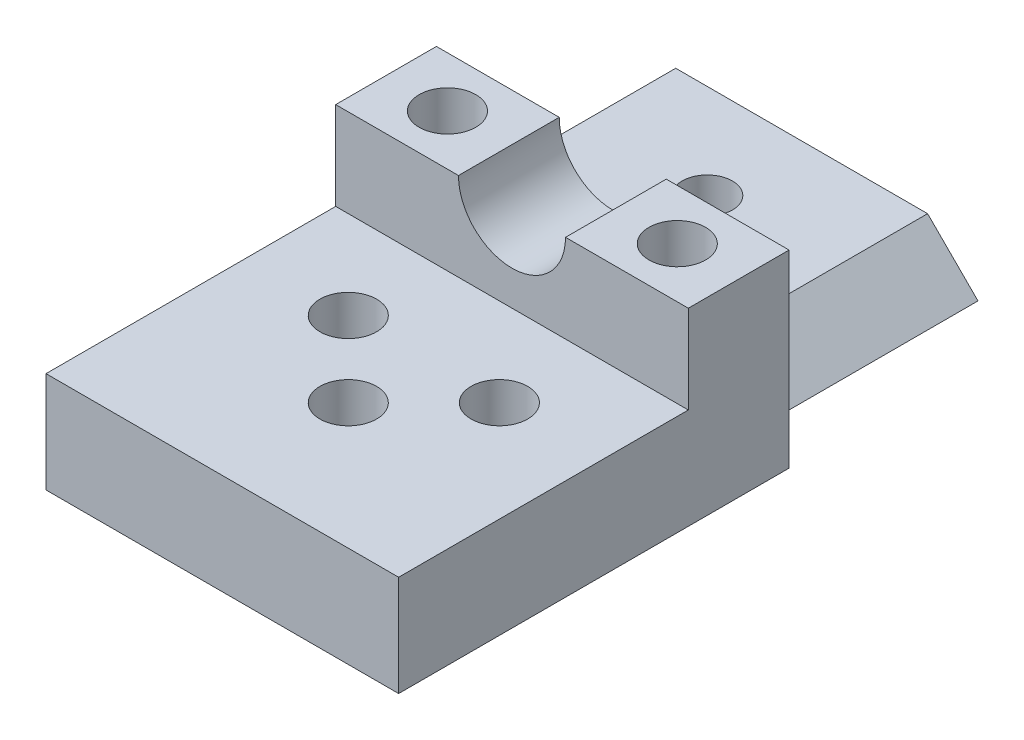
from build123d import *

# Parameters (mm, degrees)
SKETCH1_W                             = 28
SKETCH1_H                             = 46
SKETCH1_R                             = 2
BOSS_EXTRUDE1_DEPTH                   = 8
SKETCH6_R                             = 2.25
DRAGCHAINMOUNTHOLESCUT_EXTRUDE1_DEPTH = 4
SKETCH2_W                             = 28
SKETCH2_H                             = 8
BRIDGEBOSS_EXTRUDE2_DEPTH             = 7
GROMMETCUT_EXTRUDE3_DEPTH             = 40.217343102
BRIDGEMOUNTHOLESSKETCH4_R             = 2.25
BRIDGEMOUNTHOLESCUT_EXTRUDE4_DEPTH    = 4
SKETCH5_W                             = 15
SKETCH5_H                             = 4
EDGECUT_EXTRUDE5_DEPTH                = 56.901699437
CHAMFER1_SIZE                         = 4


with BuildPart() as part:
    # Sketch1 → Boss-Extrude1 (new body)
    with BuildSketch(Plane(origin=(0, 0, 0), x_dir=(1, 0, 0), z_dir=(0, 1, 0))):
        with Locations((14, 23)):
            Rectangle(SKETCH1_W, SKETCH1_H)
        with Locations(Location((14, 38.5, 0), (0, 0, 270))):
            Circle(SKETCH1_R, mode=Mode.SUBTRACT)
    extrude(amount=BOSS_EXTRUDE1_DEPTH)

    # Sketch6 → DragChainMountHolesCut-Extrude1 (cut)
    with BuildSketch(Plane(origin=(0, 8, 0), x_dir=(1, 0, 0), z_dir=(0, 1, 0))):
        with Locations(Location((8, 16, 0), (0, 0, 270))):
            Circle(SKETCH6_R)
        with Locations(Location((19.996983409, 16, 0), (0, 0, 270))):
            Circle(SKETCH6_R)
        with Locations(Location((14, 10, 0), (0, 0, 270))):
            Circle(SKETCH6_R)
    extrude(amount=-DRAGCHAINMOUNTHOLESCUT_EXTRUDE1_DEPTH, mode=Mode.SUBTRACT)

    # Sketch2 → BridgeBoss-Extrude2 (add)
    with BuildSketch(Plane(origin=(0, 8, 0), x_dir=(1, 0, 0), z_dir=(0, 1, 0))):
        with Locations((14, 27)):
            Rectangle(SKETCH2_W, SKETCH2_H)
    extrude(amount=BRIDGEBOSS_EXTRUDE2_DEPTH)

    # Sketch3 → GrommetCut-Extrude3 (cut, through all)
    with BuildSketch(Plane.XY.offset(-23)):
        with BuildLine():
            Line((9.75, 15), (18.25, 15))
            ThreePointArc((18.25, 15), (14, 10.75), (9.75, 15))
        make_face()
    extrude(amount=-GROMMETCUT_EXTRUDE3_DEPTH, mode=Mode.SUBTRACT)

    # BridgeMountHolesSketch4 → BridgeMountholesCut-Extrude4 (cut)
    with BuildSketch(Plane(origin=(0, 15, 0), x_dir=(1, 0, 0), z_dir=(0, 1, 0))):
        with Locations(Location((4.875, 27, 0), (0, 0, 270))):
            Circle(BRIDGEMOUNTHOLESSKETCH4_R)
        with Locations(Location((23.125, 27, 0), (0, 0, 270))):
            Circle(BRIDGEMOUNTHOLESSKETCH4_R)
    extrude(amount=-BRIDGEMOUNTHOLESCUT_EXTRUDE4_DEPTH, mode=Mode.SUBTRACT)

    # Sketch5 → EdgeCut-Extrude5 (cut, through all)
    with BuildSketch(Plane.ZY):
        with Locations((-38.5, 2)):
            Rectangle(SKETCH5_W, SKETCH5_H)
    extrude(amount=-EDGECUT_EXTRUDE5_DEPTH, mode=Mode.SUBTRACT)

    # Chamfer1
    chamfer1_edges = [part.edges().sort_by_distance(p)[0] for p in [
        (28, 8, -38.5),
        (0, 8, -38.5),
    ]]
    chamfer(chamfer1_edges, length=CHAMFER1_SIZE - 0.0001)  # a hair under: the kernel refuses the full size


solid = part.part
